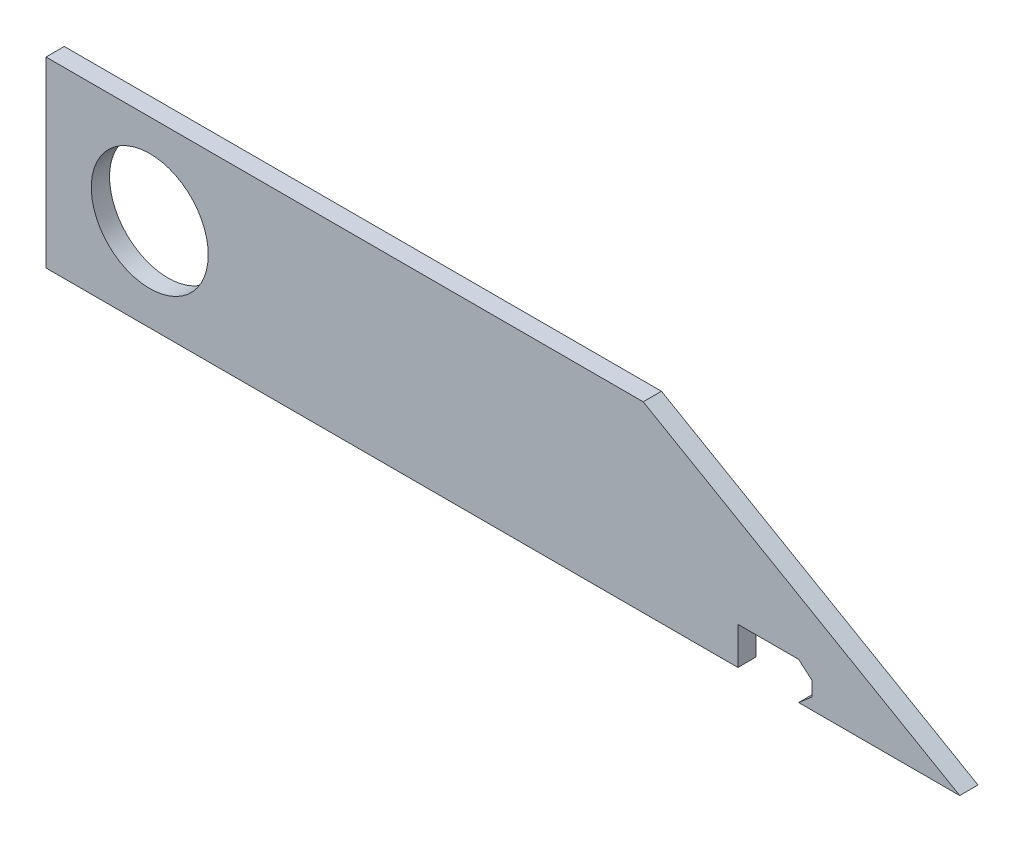
from build123d import *

# Parameters (mm, degrees)
BOSS_EXTRUDE1_DEPTH = 2.54
SKETCH3_R           = 8.128
CUT_EXTRUDE1_DEPTH  = 2.54
CUT_EXTRUDE2_DEPTH  = 70.365276616


with BuildPart() as part:
    # Sketch2 → Boss-Extrude1 (new body)
    with BuildSketch(Plane.XY):
        Polygon((-63.5, 2.4), (63.5, 2.4), (19.505909488, 27.8), (-63.5, 27.8), align=None)
    extrude(amount=-BOSS_EXTRUDE1_DEPTH)

    # Sketch3 → Cut-Extrude1 (cut)
    with BuildSketch(Plane.XY):
        with Locations((-49.078344927, 15.263552957)):
            Circle(SKETCH3_R)
    extrude(amount=-CUT_EXTRUDE1_DEPTH, mode=Mode.SUBTRACT)

    # Sketch4 → Cut-Extrude2 (cut, through all)
    with BuildSketch(Plane(origin=(0, 0, -2.54), x_dir=(-1, 0, 0), z_dir=(0, 0, -1))):
        Polygon((-41.105403431, 7.6), (-32.667342272, 7.6), (-32.667342272, 2.4), (-41.105403431, 2.4), (-42.967342272, 4), (-42.967342272, 6), align=None)
    extrude(amount=-CUT_EXTRUDE2_DEPTH, mode=Mode.SUBTRACT)


solid = part.part
